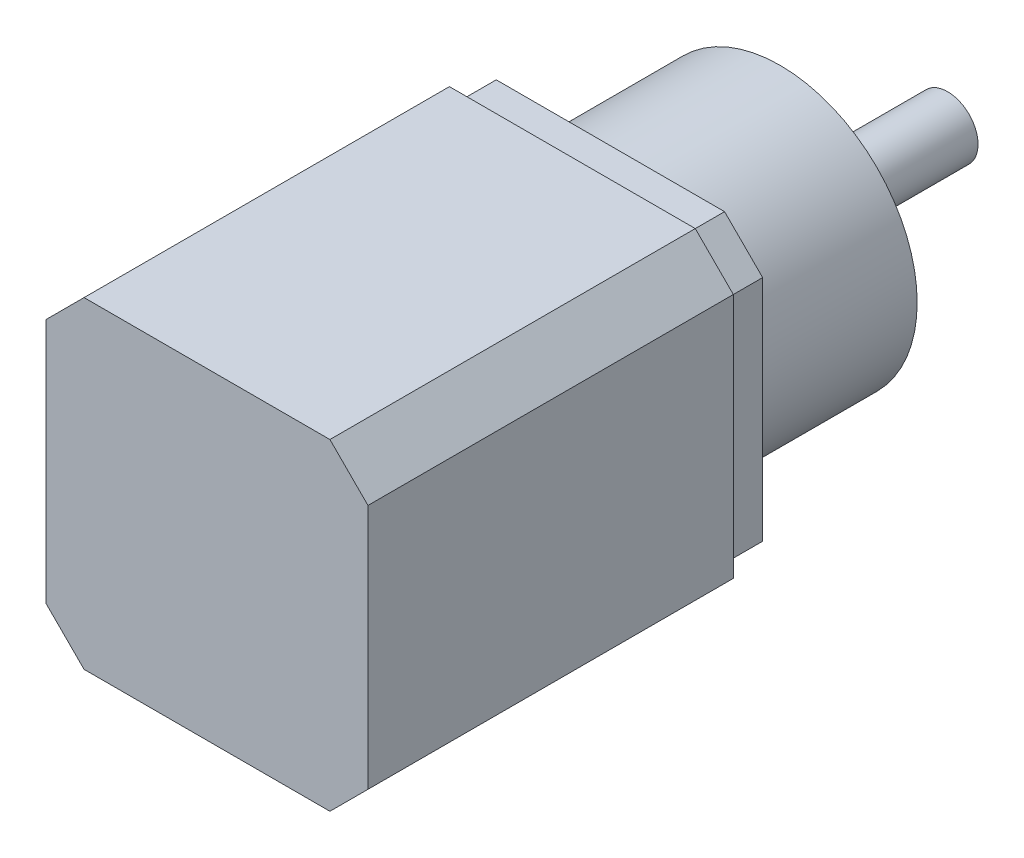
from build123d import *

# Parameters (mm, degrees)
SKETCH1_W           = 42.3
SKETCH1_H           = 42.3
BOSS_EXTRUDE1_DEPTH = 48
CHAMFER1_SIZE       = 5
SKETCH2_W           = 40
SKETCH2_H           = 40
BOSS_EXTRUDE2_DEPTH = 5
CHAMFER2_SIZE       = 5
SKETCH3_R           = 18
BOSS_EXTRUDE3_DEPTH = 22.3
SKETCH4_R           = 11
BOSS_EXTRUDE4_DEPTH = 2
SKETCH5_R           = 4
BOSS_EXTRUDE5_DEPTH = 20
SKETCH6_R           = 6.210975092
BOSS_EXTRUDE6_DEPTH = 0.5
SKETCH7_R           = 1.25
CUT_EXTRUDE1_DEPTH  = 5
SKETCH8_W           = 4.27994847
SKETCH8_H           = 8.688986299
CUT_EXTRUDE2_DEPTH  = 15


with BuildPart() as part:
    # Sketch1 → Boss-Extrude1 (new body)
    with BuildSketch(Plane.XY):
        Rectangle(SKETCH1_W, SKETCH1_H)
    extrude(amount=BOSS_EXTRUDE1_DEPTH)

    # Chamfer1
    chamfer1_edges = [part.edges().sort_by_distance(p)[0] for p in [
        (21.15, -21.15, 24),
        (-21.15, -21.15, 24),
        (-21.15, 21.15, 24),
        (21.15, 21.15, 24),
    ]]
    chamfer(chamfer1_edges, length=CHAMFER1_SIZE)

    # Sketch2 → Boss-Extrude2 (add)
    with BuildSketch(Plane(origin=(0, 0, 0), x_dir=(-1, 0, 0), z_dir=(0, 0, -1))):
        Rectangle(SKETCH2_W, SKETCH2_H)
    extrude(amount=BOSS_EXTRUDE2_DEPTH)

    # Chamfer2
    # the kernel refuses this chamfer: 5 mm, written as the material it takes off along each edge
    with BuildSketch(Plane(origin=(-20, -20, 0), x_dir=(-0.027495876610586317, 0.9996219169112968, 0), z_dir=(0, 0, -1)), Plane(origin=(-20, 20, 0), x_dir=(0.9996219169112968, 0.027495876610586317, 0), z_dir=(0, 0, -1))) as chamfer2_piece_1:
        Polygon((CHAMFER2_SIZE * 0.999621916911, CHAMFER2_SIZE * 0.0274958766106), (-CHAMFER2_SIZE * 0.0274958766106, CHAMFER2_SIZE * 0.999621916911), (0, 0), align=None)
    extrude(amount=17.85841494, mode=Mode.SUBTRACT)
    with BuildSketch(Plane(origin=(20, 20, 0), x_dir=(-0.9996219169112968, 0.027495876610586317, 0), z_dir=(0, 0, -1)), Plane(origin=(20, -20, 0), x_dir=(0.027495876610586317, 0.9996219169112968, 0), z_dir=(0, 0, -1))) as chamfer2_piece_2:
        Polygon((CHAMFER2_SIZE * 0.999621916911, -CHAMFER2_SIZE * 0.0274958766106), (-CHAMFER2_SIZE * 0.0274958766106, -CHAMFER2_SIZE * 0.999621916911), (0, 0), align=None)
    extrude(amount=17.85841494, mode=Mode.SUBTRACT)

    # Sketch3 → Boss-Extrude3 (add)
    with BuildSketch(Plane(origin=(0, 0, -5), x_dir=(-1, 0, 0), z_dir=(0, 0, -1))):
        with Locations(Location((0, 0, 0), (0, 0, 180))):
            Circle(SKETCH3_R)
    extrude(amount=BOSS_EXTRUDE3_DEPTH)

    # Sketch4 → Boss-Extrude4 (add)
    with BuildSketch(Plane(origin=(0, 0, -27.3), x_dir=(-1, 0, 0), z_dir=(0, 0, -1))):
        Circle(SKETCH4_R)
    extrude(amount=BOSS_EXTRUDE4_DEPTH)

    # Sketch5 → Boss-Extrude5 (add)
    with BuildSketch(Plane(origin=(0, 0, -29.3), x_dir=(-1, 0, 0), z_dir=(0, 0, -1))):
        Circle(SKETCH5_R)
    extrude(amount=BOSS_EXTRUDE5_DEPTH)

    # Sketch6 → Boss-Extrude6 (add)
    with BuildSketch(Plane(origin=(0, 0, -29.3), x_dir=(-1, 0, 0), z_dir=(0, 0, -1))):
        Circle(SKETCH6_R)
    extrude(amount=BOSS_EXTRUDE6_DEPTH)

    # Sketch7 → Cut-Extrude1 (cut)
    with BuildSketch(Plane(origin=(0, 0, -27.3), x_dir=(-1, 0, 0), z_dir=(0, 0, -1))):
        with Locations((9.899494937, 9.899494937)):
            Circle(SKETCH7_R)
        with Locations((9.899494937, -9.899494937)):
            Circle(SKETCH7_R)
        with Locations((-9.899494937, -9.899494937)):
            Circle(SKETCH7_R)
        with Locations((-9.899494937, 9.899494937)):
            Circle(SKETCH7_R)
    extrude(amount=-CUT_EXTRUDE1_DEPTH, mode=Mode.SUBTRACT)

    # Sketch8 → Cut-Extrude2 (cut)
    with BuildSketch(Plane(origin=(0, 0, -49.3), x_dir=(-1, 0, 0), z_dir=(0, 0, -1))):
        with Locations((5.139974235, -0.230171823)):
            Rectangle(SKETCH8_W, SKETCH8_H)
    extrude(amount=-CUT_EXTRUDE2_DEPTH, mode=Mode.SUBTRACT)


solid = part.part
